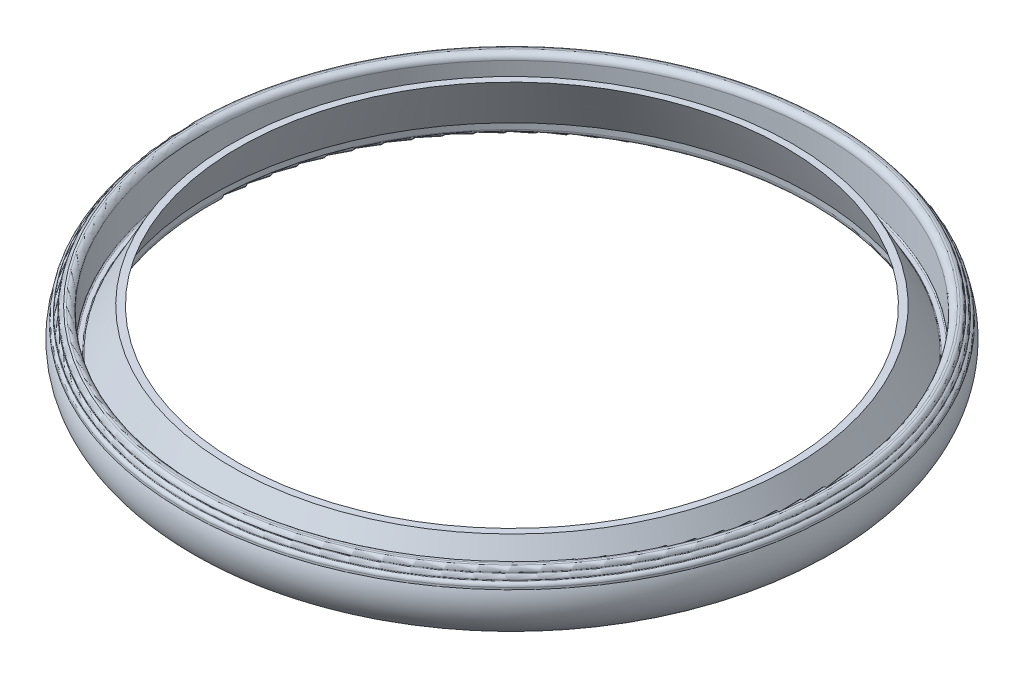
from build123d import *

# Parameters (mm, degrees)
FILLET1_R = 0.508
FILLET2_R = 2.54
FILLET3_R = 1.778
FILLET4_R = 0.254


with BuildPart() as part:
    # Sketch1 → Revolve1 (revolve)
    with BuildSketch(Plane.XY, mode=Mode.PRIVATE) as revolve1_sk:
        with BuildLine():
            ThreePointArc((-134.61999999999998, 6.22e-15), (-132.82394877578616, 0.7439487757861636), (-132.08, 2.539999999999967))
            Line((-132.08, 2.539999999999967), (-132.08, 5.07999999999995))
            Line((-132.08, 5.07999999999995), (-120.44548495066127, 28.82899999999998))
            Line((-120.44548495066127, 28.82899999999998), (-123.47751915283212, 28.828999999999994))
            Line((-123.47751915283212, 28.828999999999994), (-133.5587948102957, 10.26159999999998))
            Line((-133.5587948102957, 10.261599999999982), (-136.09589627678233, 10.261599999999978))
            Line((-136.09589627678233, 10.26159999999998), (-136.09589627678233, 28.796221133435314))
            Line((-136.09589627678233, 28.796221133435314), (-141.2577787244145, 28.34461493681401))
            Line((-141.2577787244145, 28.34461493681401), (-141.34950272132588, 26.594416814203147))
            Line((-141.34950272132588, 26.594416814203147), (-142.71588336922852, 26.474873997450448))
            Line((-142.71588336922852, 26.474873997450448), (-142.8115953660056, 24.648580304291283))
            Line((-142.8115953660056, 24.648580304291283), (-144.05145928725057, 24.540106266867536))
            Line((-144.05145928725057, 24.540106266867536), (-144.1764166163762, 22.155778389687516))
            ThreePointArc((-144.1764166163762, 22.15577838968752), (-143.83575863309818, 9.163847678671385), (-134.61999999999998, -3.55e-15))
        make_face()
    revolve(revolve1_sk.sketch.rotate(Axis((0, 0, 0), (0, 1, 0)), 270), axis=Axis((0, 0, 0), (0, 1, 0)))

    # Fillet1
    fillet1_edges = [part.edges().sort_by_distance(p)[0] for p in [
        (-4.689e-14, 10.26159999999998, 136.09589627678233),
        (-4.601e-14, 10.26159999999998, 133.5587948102957),
    ]]
    fillet(fillet1_edges, radius=FILLET1_R)

    # Fillet2
    fillet2_edges = [part.edges().sort_by_distance(p)[0] for p in [
        (-4.689e-14, 28.796221133435314, 136.09589627678233),
    ]]
    fillet(fillet2_edges, radius=FILLET2_R)

    # Fillet3
    # the kernel refuses this fillet: 1.778 mm, written as the material it takes off along each edge
    with BuildSketch(Plane(origin=(0, 24.540106266867536, 0), x_dir=(2.2e-16, 0, -1), z_dir=(1, 0, 2.2e-16))) as fillet3_piece_1:
        with BuildLine():
            CenterArc((142.35539598051716, -1.6100038125103815), FILLET3_R, 2.999999999999552, 72.13276738690263)
            Line((144.13095929331078, -1.5169504823104418), (144.16647055956665, -1.5150894157064414))
            Line((144.16647055956665, -1.5150894157064414), (144.08697055350643, 0.00186106660400043))
            Line((144.08697055350643, 0.00186106660400043), (144.05455854546267, 0.03542468346414296))
            ThreePointArc((144.05455854546267, 0.03542468346414296), (143.43462658483938, 0.08966170217608749), (142.82071935371286, 0.14284359441293049))
            Line((142.82071935371286, 0.14284359441293049), (142.81159536600313, 0.10847403741443529))
        make_face()
    fillet3_piece_1_solid = revolve(axis=Axis((0, 24.540106266867536, 0), (0, 1, 0)), mode=Mode.PRIVATE)
    with BuildSketch(Plane(origin=(0, 26.474873997450448, 0), x_dir=(2.2e-16, 0, -1), z_dir=(1, 0, 2.2e-16))) as fillet3_piece_2:
        with BuildLine():
            CenterArc((141.0207527290087, -1.6278001497400005), FILLET3_R, 2.999999999999666, 76.34477015301434)
            Line((142.79631604180233, -1.5347468195400573), (142.8318273080582, -1.532885752936057))
            Line((142.8318273080582, -1.532885752936057), (142.7513946354844, 0.00186106660400043))
            Line((142.7513946354844, 0.00186106660400043), (142.71898262744062, 0.03542468346414296))
            ThreePointArc((142.71898262744062, 0.03542468346414296), (142.0357923034893, 0.09519609184049216), (141.35607772117223, 0.15448967608254094))
            Line((141.35607772117223, 0.15448967608254094), (141.34950272132588, 0.11954281675268774))
        make_face()
    fillet3_piece_2_solid = revolve(axis=Axis((0, 26.474873997450448, 0), (0, 1, 0)), mode=Mode.PRIVATE)
    with BuildSketch(Plane(origin=(0, 28.34461493681401, 0), x_dir=(2.2e-16, 0, -1), z_dir=(1, 0, 2.2e-16))) as fillet3_piece_3:
        with BuildLine():
            CenterArc((141.2577787244145 - FILLET3_R * 0.953134582082, -FILLET3_R * 0.920431366797), FILLET3_R, 3.000000000000009, 81.9999999999996)
            Line((141.2577787244145 + FILLET3_R * 0.0454949526729, -FILLET3_R * 0.868095410554), (141.2577787244145 + FILLET3_R * 0.065467543368, -FILLET3_R * 0.867048691429))
            Line((141.2577787244145 + FILLET3_R * 0.065467543368, -FILLET3_R * 0.867048691429), (141.2577787244145 + FILLET3_R * 0.0190626916416, FILLET3_R * 0.0184086273359))
            Line((141.2577787244145 + FILLET3_R * 0.0190626916416, FILLET3_R * 0.0184086273359), (141.2577787244145 - FILLET3_R * 0.864235724479, FILLET3_R * 0.0956872252569))
            Line((141.2577787244145 - FILLET3_R * 0.864235724479, FILLET3_R * 0.0956872252569), (141.2577787244145 - FILLET3_R * 0.865978839334, FILLET3_R * 0.0757633312951))
        make_face()
    fillet3_piece_3_solid = revolve(axis=Axis((0, 28.34461493681401, 0), (0, 1, 0)), mode=Mode.PRIVATE)
    add([fillet3_piece_1_solid, fillet3_piece_2_solid, fillet3_piece_3_solid], mode=Mode.SUBTRACT)

    # Fillet4
    fillet4_edges = [part.edges().sort_by_distance(p)[0] for p in [
        (-4.92e-14, 24.648580304291283, 142.8115953660056),
        (-4.87e-14, 26.594416814203147, 141.34950272132588),
    ]]
    fillet(fillet4_edges, radius=FILLET4_R)


solid = part.part
